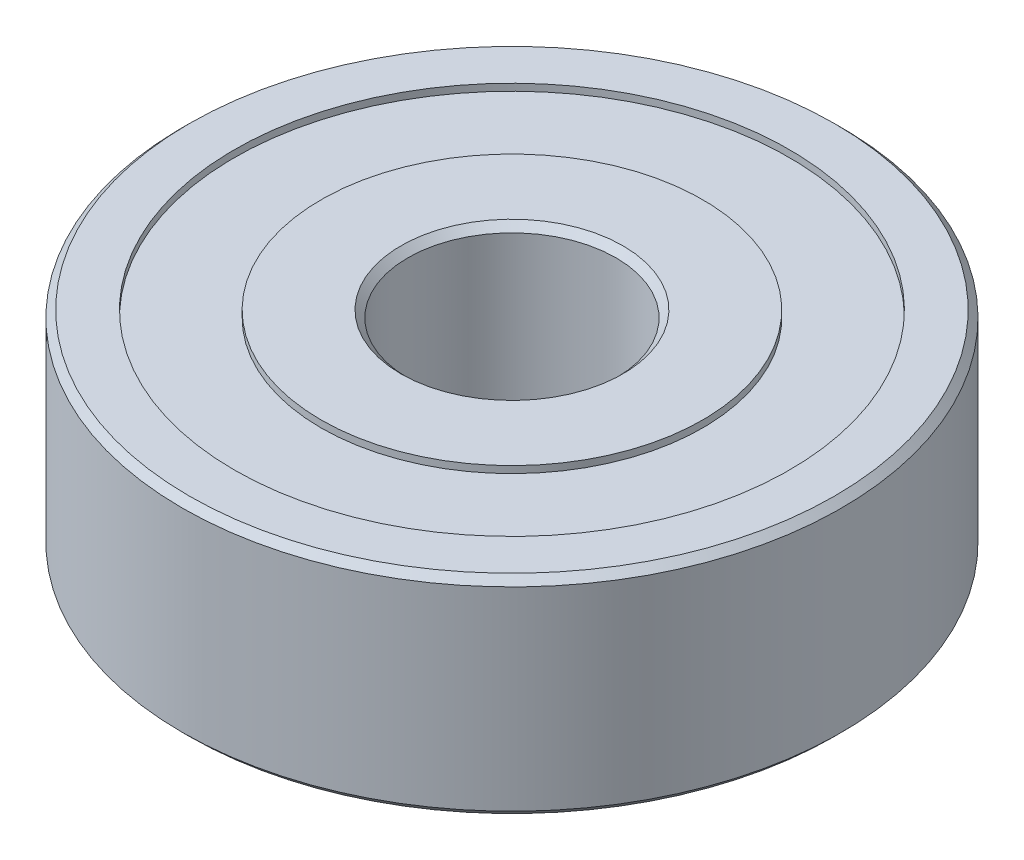
from build123d import *

# Parameters (mm, degrees)
SKETCH1_R           = 9.5
SKETCH1_R_2         = 3
BOSS_EXTRUDE1_DEPTH = 6
SKETCH2_R           = 8
SKETCH2_R_2         = 5.5
CUT_EXTRUDE1_DEPTH  = 0.2
CUT_EXTRUDE2_START  = -0.2
SKETCH3_R           = 8
SKETCH3_R_2         = 5.5
CUT_EXTRUDE2_DEPTH  = 0.2
CHAMFER1_SIZE       = 0.2


with BuildPart() as part:
    # Sketch1 → Boss-Extrude1 (new body)
    with BuildSketch(Plane(origin=(0, 0, 0), x_dir=(1, 0, 0), z_dir=(0, 1, 0))):
        Circle(SKETCH1_R)
        Circle(SKETCH1_R_2, mode=Mode.SUBTRACT)
    extrude(amount=BOSS_EXTRUDE1_DEPTH)

    # Sketch2 → Cut-Extrude1 (cut)
    with BuildSketch(Plane(origin=(0, 6, 0), x_dir=(1, 0, 0), z_dir=(0, 1, 0))):
        Circle(SKETCH2_R)
        Circle(SKETCH2_R_2, mode=Mode.SUBTRACT)
    extrude(amount=-CUT_EXTRUDE1_DEPTH, mode=Mode.SUBTRACT)

    # Sketch3 → Cut-Extrude2 (cut)
    with BuildSketch(Plane.XZ.offset(CUT_EXTRUDE2_START)):
        Circle(SKETCH3_R)
        Circle(SKETCH3_R_2, mode=Mode.SUBTRACT)
    extrude(amount=CUT_EXTRUDE2_DEPTH, mode=Mode.SUBTRACT)

    # Chamfer1
    chamfer1_edges = [part.edges().sort_by_distance(p)[0] for p in [
        (-9.5, 6, 0),
        (-9.5, 0, 0),
        (-3, 6, 0),
        (-3, 0, 0),
    ]]
    chamfer(chamfer1_edges, length=CHAMFER1_SIZE)


solid = part.part
